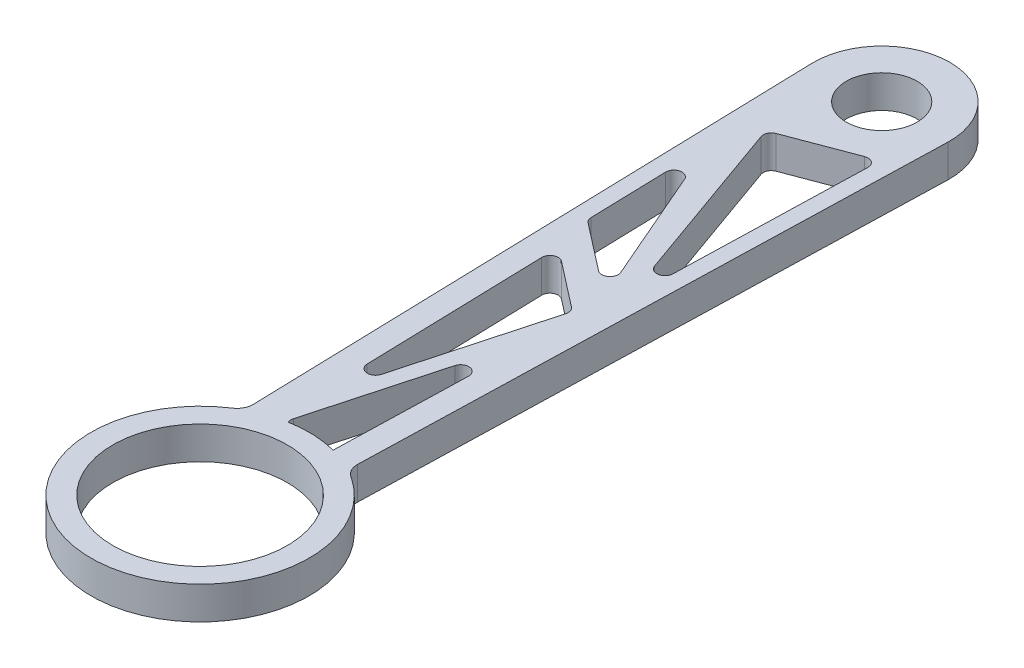
from build123d import *

# Parameters (mm, degrees)
SKETCH_1_R          = 5.05
SKETCH_1_R_2        = 13
EXTRUDE_1_DEPTH     = 12
FILLET_1_R          = 3
CUT_EXTRUDE_3_DEPTH = 277.39464539
FILLET_2_R          = 3
EXTRUDE_START       = -12
SKETCH_5_R          = 40
SKETCH_5_R_2        = 5.05
EXTRUDE_2_DEPTH     = 12
FILLET_3_R          = 6
EXTRUDE_3_DEPTH     = 12
FILLET_4_R          = 3
SKETCH_8_R          = 32
CUT_EXTRUDE_5_DEPTH = 279.152835686


with BuildPart() as part:
    # 草图1 → 凸台-拉伸1 (new body)
    with BuildSketch(Plane(origin=(0, 0, 0), x_dir=(1, 0, 0), z_dir=(0, 1, 0))):
        with BuildLine():
            Line((-17.992942616, -0.504), (-24.990198078, 249.3))
            ThreePointArc((-24.990198078, 249.3), (0, 275), (24.990198078, 249.3))
            Line((24.990198078, 249.3), (17.992942616, -0.504))
            ThreePointArc((17.992942616, -0.504), (0, -18), (-17.992942616, -0.504))
        make_face()
        with Locations(Location((0, 0, 0), (0, 0, 270))):
            Circle(SKETCH_1_R, mode=Mode.SUBTRACT)
        with Locations(Location((0, 250, 0), (0, 0, 270))):
            Circle(SKETCH_1_R_2, mode=Mode.SUBTRACT)
        Polygon((-16.444447487, 158.5), (-17.704941698, 203.5), (11.028871219, 137.174942267), align=None, mode=Mode.SUBTRACT)
        Polygon((15.954255294, 141), (18.475243716, 231), (-12, 219.5), align=None, mode=Mode.SUBTRACT)
    extrude(amount=EXTRUDE_1_DEPTH)

    # 圆角1
    fillet_1_edges = [part.edges().sort_by_distance(p)[0] for p in [
        (-16.444447487, 6, -158.5),
        (11.028871219, 6, -137.174942267),
        (-17.704941698, 6, -203.5),
        (18.475243716, 6, -231),
        (-12, 6, -219.5),
        (15.954255294, 6, -141),
    ]]
    fillet(fillet_1_edges, radius=FILLET_1_R)

    # 草图4 → 切除-拉伸3 (cut, through all)
    with BuildSketch(Plane(origin=(0, 12, 0), x_dir=(1, 0, 0), z_dir=(0, 1, 0))):
        Polygon((-13.050343026, 144.472367448), (12.494927596, 124.643879429), (9.742058902, 26.365688077), (-10.175105816, 41.825585442), align=None)
    extrude(amount=-CUT_EXTRUDE_3_DEPTH, mode=Mode.SUBTRACT)

    # 圆角2
    fillet_2_edges = [part.edges().sort_by_distance(p)[0] for p in [
        (-10.175105816, 6, -41.825585442),
        (-13.050343026, 6, -144.472367448),
        (9.742058902, 6, -26.365688077),
    ]]
    fillet(fillet_2_edges, radius=FILLET_2_R)

    # 草图5 → 凸台-拉伸2 (add)
    with BuildSketch(Plane(origin=(0, 12, 0), x_dir=(1, 0, 0), z_dir=(0, 1, 0)).offset(EXTRUDE_START)):
        Circle(SKETCH_5_R)
        with Locations(Location((0, 0, 0), (0, 0, 270))):
            Circle(SKETCH_5_R_2, mode=Mode.SUBTRACT)
    extrude(amount=EXTRUDE_2_DEPTH)

    # 圆角3
    fillet_3_edges = [part.edges().sort_by_distance(p)[0] for p in [
        (18.993134598, 6, -35.203136766),
        (-18.993134598, 6, -35.203136766),
    ]]
    fillet(fillet_3_edges, radius=FILLET_3_R)

    # 草图6 → 凸台-拉伸3 (add)
    with BuildSketch(Plane(origin=(0, 12, 0), x_dir=(1, 0, 0), z_dir=(0, 1, 0))):
        Polygon((9.60137553, 125.435937788), (-13.068657882, 42.617643801), (-7.609801347, 39.834371112), (-7.28155375, 41.033527083), (15.388479662, 123.85182107), (9.929623127, 126.635093759), align=None)
    extrude(amount=-EXTRUDE_3_DEPTH)

    # 圆角4
    # the kernel refuses this fillet: 3 mm, written as the material it adds along each edge
    with BuildSketch(Plane(origin=(12.14036175, 0, -111.985778385), x_dir=(-0.028000000000000382, 0, 0.9996079231378672), z_dir=(0, 1, 0))) as fillet_4_piece_1:
        with BuildLine():
            CenterArc((FILLET_4_R * 8.32187878655, -FILLET_4_R), FILLET_4_R, 90, 166.295794849)
            Line((FILLET_4_R * 8.08496933551, -FILLET_4_R * 1.97153173495), (FILLET_4_R * 8.08023114649, -FILLET_4_R * 1.99096236965))
            Line((FILLET_4_R * 8.08023114649, -FILLET_4_R * 1.99096236965), (-FILLET_4_R * 0.0047381890208, -FILLET_4_R * 0.0194306346989))
            Line((-FILLET_4_R * 0.0047381890208, -FILLET_4_R * 0.0194306346989), (0, FILLET_4_R * 0.02))
            Line((0, FILLET_4_R * 0.02), (FILLET_4_R * 8.32187878655, FILLET_4_R * 0.02))
            Line((FILLET_4_R * 8.32187878655, FILLET_4_R * 0.02), (FILLET_4_R * 8.32187878655, 0))
        make_face()
    extrude(amount=12)
    with BuildSketch(Plane(origin=(-10.463842583, 0, -52.133569747), x_dir=(-0.02799999999999904, 0, -0.9996079231378672), z_dir=(0, 1, 0))) as fillet_4_piece_2:
        with BuildLine():
            CenterArc((FILLET_4_R * 6.72600834912, -FILLET_4_R), FILLET_4_R, 90, 163.086811796)
            Line((FILLET_4_R * 6.43508592619, -FILLET_4_R * 1.95674664558), (FILLET_4_R * 6.42926747773, -FILLET_4_R * 1.9758815785))
            Line((FILLET_4_R * 6.42926747773, -FILLET_4_R * 1.9758815785), (-FILLET_4_R * 0.00581844845863, -FILLET_4_R * 0.0191349329117))
            Line((-FILLET_4_R * 0.00581844845863, -FILLET_4_R * 0.0191349329117), (0, FILLET_4_R * 0.02))
            Line((0, FILLET_4_R * 0.02), (FILLET_4_R * 6.72600834912, FILLET_4_R * 0.02))
            Line((FILLET_4_R * 6.72600834912, FILLET_4_R * 0.02), (FILLET_4_R * 6.72600834912, 0))
        make_face()
    extrude(amount=12)
    with BuildSketch(Plane(origin=(9.929623127, 12, -126.635093759), x_dir=(-0.7899521186549702, 0, -0.6131685333026506), z_dir=(0, -1, 0))) as fillet_4_piece_3:
        with BuildLine():
            CenterArc((FILLET_4_R * 0.668049057951, -FILLET_4_R), FILLET_4_R, 90, 67.489733811)
            Line((-FILLET_4_R * 0.255761890972, -FILLET_4_R * 0.617151034153), (-FILLET_4_R * 0.27423810995, -FILLET_4_R * 0.609494054836))
            Line((-FILLET_4_R * 0.27423810995, -FILLET_4_R * 0.609494054836), (-FILLET_4_R * 0.013360981159, FILLET_4_R * 0.02))
            Line((-FILLET_4_R * 0.013360981159, FILLET_4_R * 0.02), (FILLET_4_R * 0.668049057951, FILLET_4_R * 0.02))
            Line((FILLET_4_R * 0.668049057951, FILLET_4_R * 0.02), (FILLET_4_R * 0.668049057951, 0))
        make_face()
    extrude(amount=12)
    with BuildSketch(Plane(origin=(-7.609801347, 12, -39.834371112), x_dir=(0.789952118654971, 0, 0.6131685333026496), z_dir=(0, -1, 0))) as fillet_4_piece_4:
        with BuildLine():
            CenterArc((2.149138752, -2.650136686), FILLET_4_R, 117.947316923, 39.542416888)
            Line((-0.622294094, -1.501589789), (-0.677722751, -1.478618851))
            Line((-0.677722751, -1.478618851), (-0.055428657, 0.022970938))
            Line((-0.055428657, 0.022970938), (0, 0.06))
            ThreePointArc((0, 0.06), (0.371580126, 0.06), (0.715040682, 0.053002734))
            Line((0.715040682, 0.053002734), (0.743160252, 0))
        make_face()
    extrude(amount=12)

    # 草图8 → 切除-拉伸5 (cut, through all)
    with BuildSketch(Plane(origin=(0, 12, 0), x_dir=(1, 0, 0), z_dir=(0, 1, 0))):
        with Locations(Location((0, 0, 0), (0, 0, 270))):
            Circle(SKETCH_8_R)
    extrude(amount=-CUT_EXTRUDE_5_DEPTH, mode=Mode.SUBTRACT)


solid = part.part
